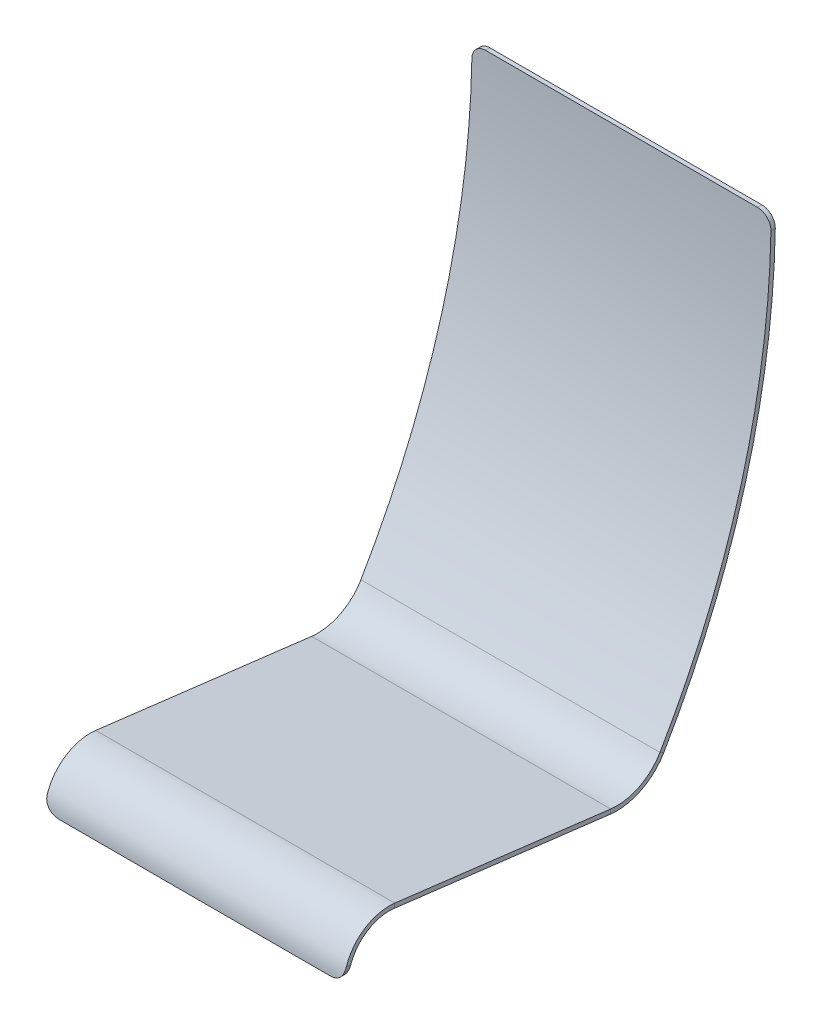
from build123d import *

# Parameters (mm, degrees)
ODGI_CIE_START         = -275
ODGI_CIE_BAZOWE1_DEPTH = 550
ZAOKR_GLENIE1_R        = 25


# Read off the part's stored shape, not the designer's step: Odgięcie bazowe1
with BuildPart() as part:
    # Odgięcie bazowe1 outline → Odgięcie bazowe1 (new body)
    with BuildSketch(Plane(origin=(0, 0, 0), x_dir=(0, 0, -1), z_dir=(1, 0, 0)).offset(ODGI_CIE_START)):
        with BuildLine():
            ThreePointArc((0.974954747, 7.940369213), (-64.137664757, -12.277636548), (-92.140200755, -74.440961373))
            Line((-92.140200755, -74.440961373), (-84.140200755, -74.440961373))
            ThreePointArc((-84.140200755, -74.440961373), (-58.836704372, -18.269282314), (0, 0))
            Line((0, 0), (397.018460657, -48.747737362))
            ThreePointArc((397.018460657, -48.747737362), (453.562640464, -39.116973792), (495.513304801, 0))
            ThreePointArc((495.513304801, 0), (648.639105254, 365.128945319), (700.894657745, 757.603167031))
            Line((700.894657745, 757.603167031), (692.894657745, 757.603167031))
            ThreePointArc((692.894657745, 757.603167031), (640.917801534, 367.222141168), (488.608672016, 4.040550224))
            ThreePointArc((488.608672016, 4.040550224), (450.014060826, -31.947065665), (397.993415404, -40.807368149))
            Line((397.993415404, -40.807368149), (0.974954747, 7.940369213))
        make_face()
    extrude(amount=ODGI_CIE_BAZOWE1_DEPTH)

    # Zaokrąglenie1
    zaokr_glenie1_edges = [part.edges().sort_by_distance(p)[0] for p in [
        (-275, -74.440961373, 88.140200755),
        (275, 757.603167031, -696.894657745),
        (275, -74.440961373, 88.140200755),
        (-275, 757.603167031, -696.894657745),
    ]]
    fillet(zaokr_glenie1_edges, radius=ZAOKR_GLENIE1_R)


solid = part.part
